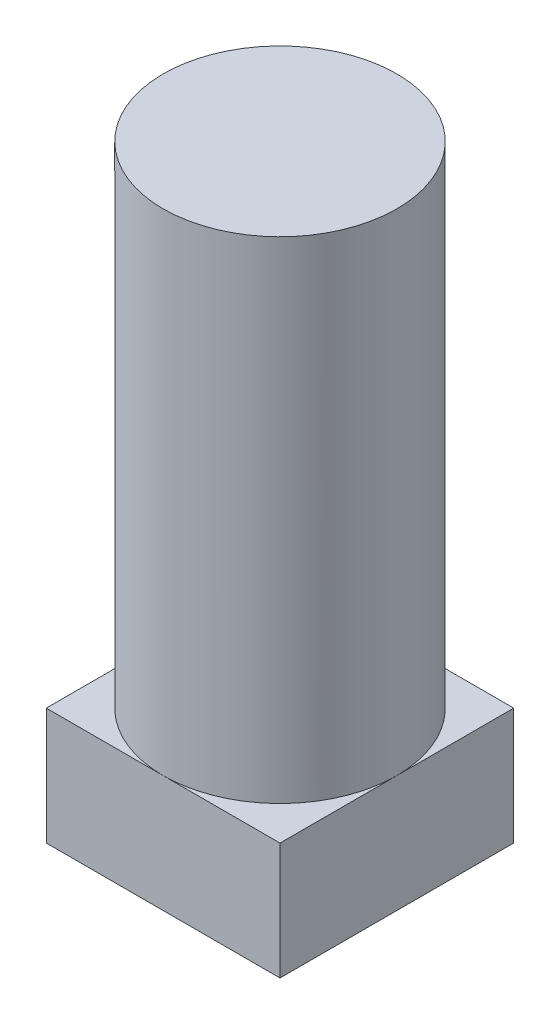
from build123d import *

# Parameters (mm, degrees)
SKETCH1_W           = 5
SKETCH1_H           = 5
BOSS_EXTRUDE1_DEPTH = 2.5
SKETCH2_R           = 2.5
BOSS_EXTRUDE2_DEPTH = 10.5


with BuildPart() as part:
    # Sketch1 → Boss-Extrude1 (new body)
    with BuildSketch(Plane(origin=(0, 0, 0), x_dir=(1, 0, 0), z_dir=(0, 1, 0))):
        Rectangle(SKETCH1_W, SKETCH1_H)
    extrude(amount=BOSS_EXTRUDE1_DEPTH)

    # Sketch2 → Boss-Extrude2 (add)
    with BuildSketch(Plane(origin=(0, 2.5, 0), x_dir=(1, 0, 0), z_dir=(0, 1, 0))):
        Circle(SKETCH2_R)
    extrude(amount=BOSS_EXTRUDE2_DEPTH)


solid = part.part
